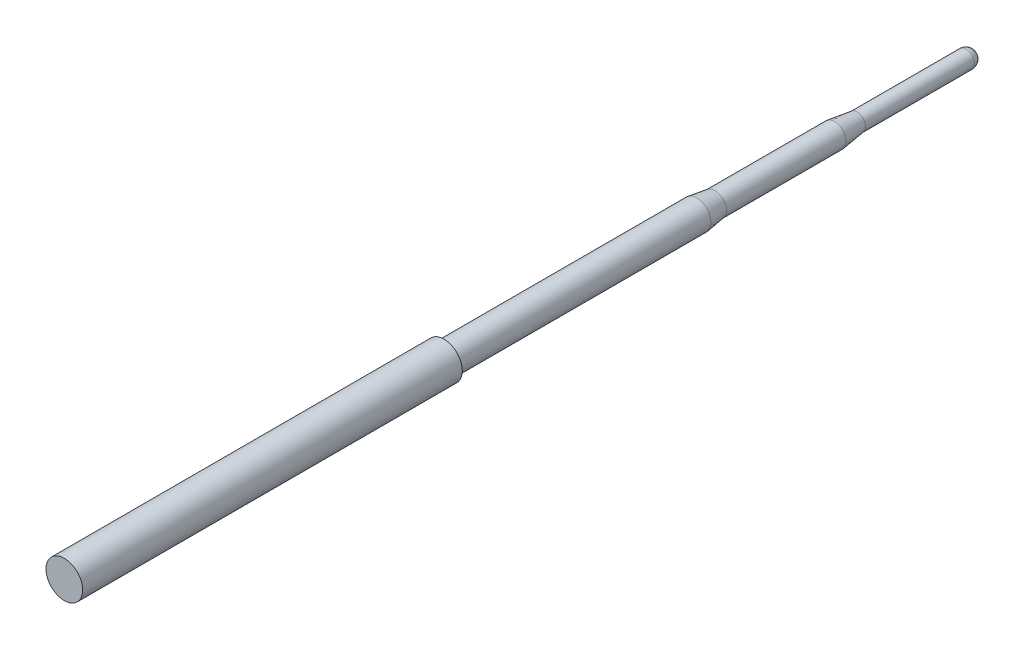
from build123d import *

# Parameters (mm, degrees)
BOSS_EXTRUDE1_START = 2.8702
SKETCH3_R           = 2.8702
BOSS_EXTRUDE1_DEPTH = 2.8702
FILLET1_R           = 2.8702


with BuildPart() as part:
    # Sketch1 → Revolve1 (revolve)
    with BuildSketch(Plane(origin=(0, 0, 0), x_dir=(0, 1, 0), z_dir=(-1, 0, 0))):
        Polygon((-4.7879, -90.061751481), (-3.8989, -83.953909649), (-3.8989, -43.999709649), (-2.8702, -36.3982), (-2.8702, 0), (0, 0), (0, -301.592951481), (-6.1341, -301.592951481), (-6.1341, -174.592951481), (-4.7879, -174.592951481), align=None)
    revolve(axis=Axis((0, 0, 0), (0, 0, 1)))

    # Sketch3 → Boss-Extrude1 (add)
    with BuildSketch(Plane(origin=(0, 0, 0), x_dir=(0, -1, 0), z_dir=(0, 0, -1)).offset(BOSS_EXTRUDE1_START)):
        Circle(SKETCH3_R)
    extrude(amount=-BOSS_EXTRUDE1_DEPTH)

    # Fillet1
    fillet1_edges = [part.edges().sort_by_distance(p)[0] for p in [
        (0, 2.8702, -2.8702),
    ]]
    fillet(fillet1_edges, radius=FILLET1_R)


solid = part.part
